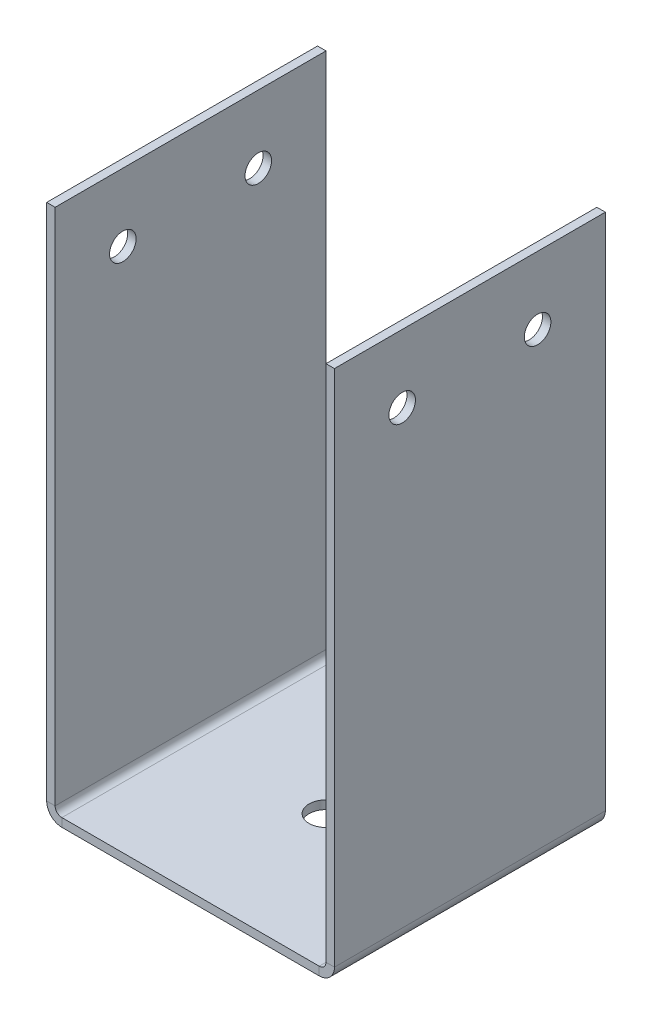
from build123d import *

# Parameters (mm, degrees)
SKETCH9_W                    = 50.8
SKETCH9_H                    = 1.5875
BASE_FLANGE1_DEPTH           = 50.8
EDGE_FLANGE1_STRIP_W         = 8.89
EDGE_FLANGE1_STRIP_H         = 1.5875
EDGE_FLANGE1_STRIP_CUT_DEPTH = 50.8
EDGE_FLANGE1_DEPTH           = 50.8
EDGE_FLANGE2_STRIP_W         = 8.89
EDGE_FLANGE2_STRIP_H         = 1.5875
EDGE_FLANGE2_STRIP_CUT_DEPTH = 50.8
EDGE_FLANGE2_DEPTH           = 50.8
SKETCH20_R                   = 2.4892
CUT_EXTRUDE1_DEPTH           = 124.263641262
CUT_EXTRUDE2_DEPTH           = 124.855948312
CUT_EXTRUDE2_DEPTH_BACK      = 124.855948312
SKETCH21_R                   = 3.175


# Sheet-metal steps are written as plain solids
with BuildPart() as part:
    # Sketch9 → Base-Flange1 (new body)
    with BuildSketch(Plane.XY):
        with Locations((25.4, -0.79375)):
            Rectangle(SKETCH9_W, SKETCH9_H)
    extrude(amount=BASE_FLANGE1_DEPTH)

    # Edge-Flange1 strip (across the edge) → Edge-Flange1 strip cut (cut)
    with BuildSketch(Plane.XY):
        with Locations((-3.175, -0.79375)):
            Rectangle(EDGE_FLANGE1_STRIP_W, EDGE_FLANGE1_STRIP_H)
    extrude(amount=EDGE_FLANGE1_STRIP_CUT_DEPTH, mode=Mode.SUBTRACT)

    # Edge-Flange1 section (across the edge) → Edge-Flange1 (add)
    with BuildSketch(Plane.XY):
        with BuildLine():
            Line((-1.5875, 1.27), (-1.5875, 98.4885))
            Line((-1.5875, 98.4885), (0, 98.4885))
            Line((0, 98.4885), (0, 1.27))
            ThreePointArc((0, 1.27), (0.371974388, 0.371974388), (1.27, 0))
            Line((1.27, 0), (1.27, -1.5875))
            ThreePointArc((1.27, -1.5875), (-0.750557627, -0.750557627), (-1.5875, 1.27))
        make_face()
    extrude(amount=EDGE_FLANGE1_DEPTH)

    # Edge-Flange2 strip (across the edge) → Edge-Flange2 strip cut (cut)
    with BuildSketch(Plane(origin=(50.8, 0, 50.8), x_dir=(-1, 0, 0), z_dir=(0, 0, -1))):
        with Locations((-3.175, -0.79375)):
            Rectangle(EDGE_FLANGE2_STRIP_W, EDGE_FLANGE2_STRIP_H)
    extrude(amount=EDGE_FLANGE2_STRIP_CUT_DEPTH, mode=Mode.SUBTRACT)

    # Edge-Flange2 section (across the edge) → Edge-Flange2 (add)
    with BuildSketch(Plane(origin=(50.8, 0, 50.8), x_dir=(-1, 0, 0), z_dir=(0, 0, -1))):
        with BuildLine():
            Line((-1.5875, 1.27), (-1.5875, 98.4885))
            Line((-1.5875, 98.4885), (0, 98.4885))
            Line((0, 98.4885), (0, 1.27))
            ThreePointArc((0, 1.27), (0.371974388, 0.371974388), (1.27, 0))
            Line((1.27, 0), (1.27, -1.5875))
            ThreePointArc((1.27, -1.5875), (-0.750557627, -0.750557627), (-1.5875, 1.27))
        make_face()
    extrude(amount=EDGE_FLANGE2_DEPTH)

    # Sketch20 → Cut-Extrude1 (cut, through all)
    with BuildSketch(Plane(origin=(52.3875, 0, 0), x_dir=(0, 0, -1), z_dir=(1, 0, 0))):
        with Locations(Location((-38.1, 85.7885, 0), (0, 0, 90))):
            Circle(SKETCH20_R)
        with Locations(Location((-12.7, 85.7885, 0), (0, 0, 90))):
            Circle(SKETCH20_R)
    extrude(amount=-CUT_EXTRUDE1_DEPTH, mode=Mode.SUBTRACT)

    # Sketch21 → Cut-Extrude2 (cut, two sides: drawn at the far end of the back side and taken through both)
    with BuildSketch(Plane.XZ.offset(1.5875).offset(-CUT_EXTRUDE2_DEPTH_BACK)):
        with Locations(Location((25.4, 25.4, 0), (0, 0, 90))):
            Circle(SKETCH21_R)
    extrude(amount=CUT_EXTRUDE2_DEPTH + CUT_EXTRUDE2_DEPTH_BACK, mode=Mode.SUBTRACT)


solid = part.part
